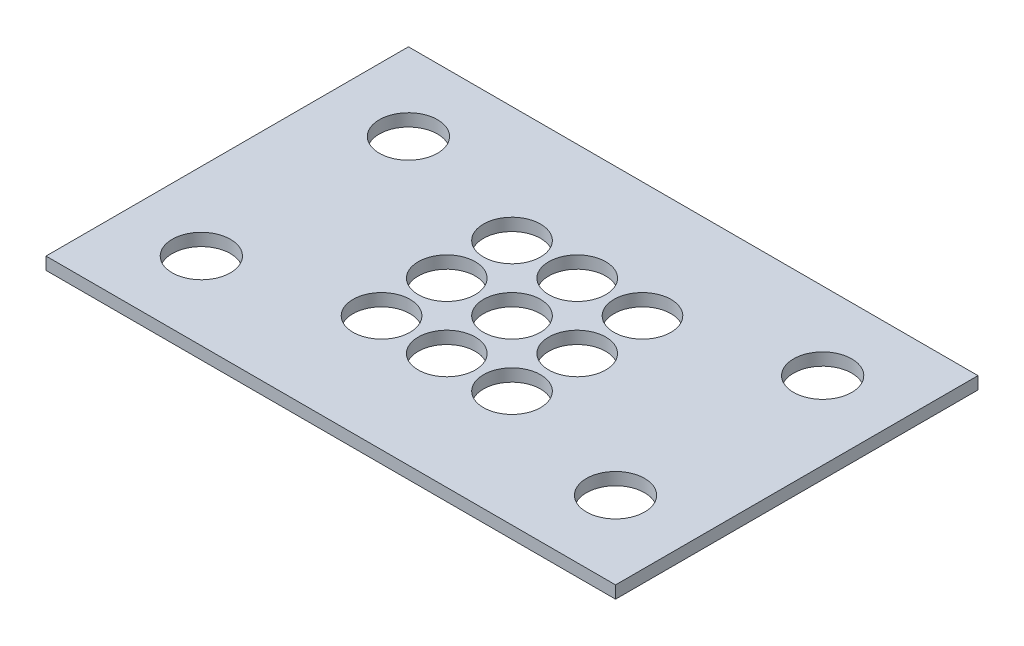
from build123d import *

# Parameters (mm, degrees)
SKETCH1_W           = 69.85
SKETCH1_H           = 44.45
SKETCH1_R           = 3.5687
SKETCH1_R_2         = 3.5
BOSS_EXTRUDE1_DEPTH = 1.524


with BuildPart() as part:
    # Sketch1 → Boss-Extrude1 (new body)
    with BuildSketch(Plane(origin=(0, 0, 0), x_dir=(1, 0, 0), z_dir=(0, 1, 0))):
        with Locations((34.925, 22.225)):
            Rectangle(SKETCH1_W, SKETCH1_H)
        with Locations((9.525, 9.525)):
            Circle(SKETCH1_R, mode=Mode.SUBTRACT)
        with Locations((26.925, 14.225)):
            Circle(SKETCH1_R_2, mode=Mode.SUBTRACT)
        with Locations((26.925, 22.225)):
            Circle(SKETCH1_R_2, mode=Mode.SUBTRACT)
        with Locations((60.325, 9.525)):
            Circle(SKETCH1_R, mode=Mode.SUBTRACT)
        with Locations((34.925, 14.225)):
            Circle(SKETCH1_R_2, mode=Mode.SUBTRACT)
        with Locations((42.925, 14.225)):
            Circle(SKETCH1_R_2, mode=Mode.SUBTRACT)
        with Locations((26.925, 30.225)):
            Circle(SKETCH1_R_2, mode=Mode.SUBTRACT)
        with Locations((34.925, 30.225)):
            Circle(SKETCH1_R_2, mode=Mode.SUBTRACT)
        with Locations((9.525, 34.925)):
            Circle(SKETCH1_R, mode=Mode.SUBTRACT)
        with Locations((34.925, 22.225)):
            Circle(SKETCH1_R_2, mode=Mode.SUBTRACT)
        with Locations((42.925, 22.225)):
            Circle(SKETCH1_R_2, mode=Mode.SUBTRACT)
        with Locations((42.925, 30.225)):
            Circle(SKETCH1_R_2, mode=Mode.SUBTRACT)
        with Locations((60.325, 34.925)):
            Circle(SKETCH1_R, mode=Mode.SUBTRACT)
    extrude(amount=BOSS_EXTRUDE1_DEPTH)


solid = part.part
